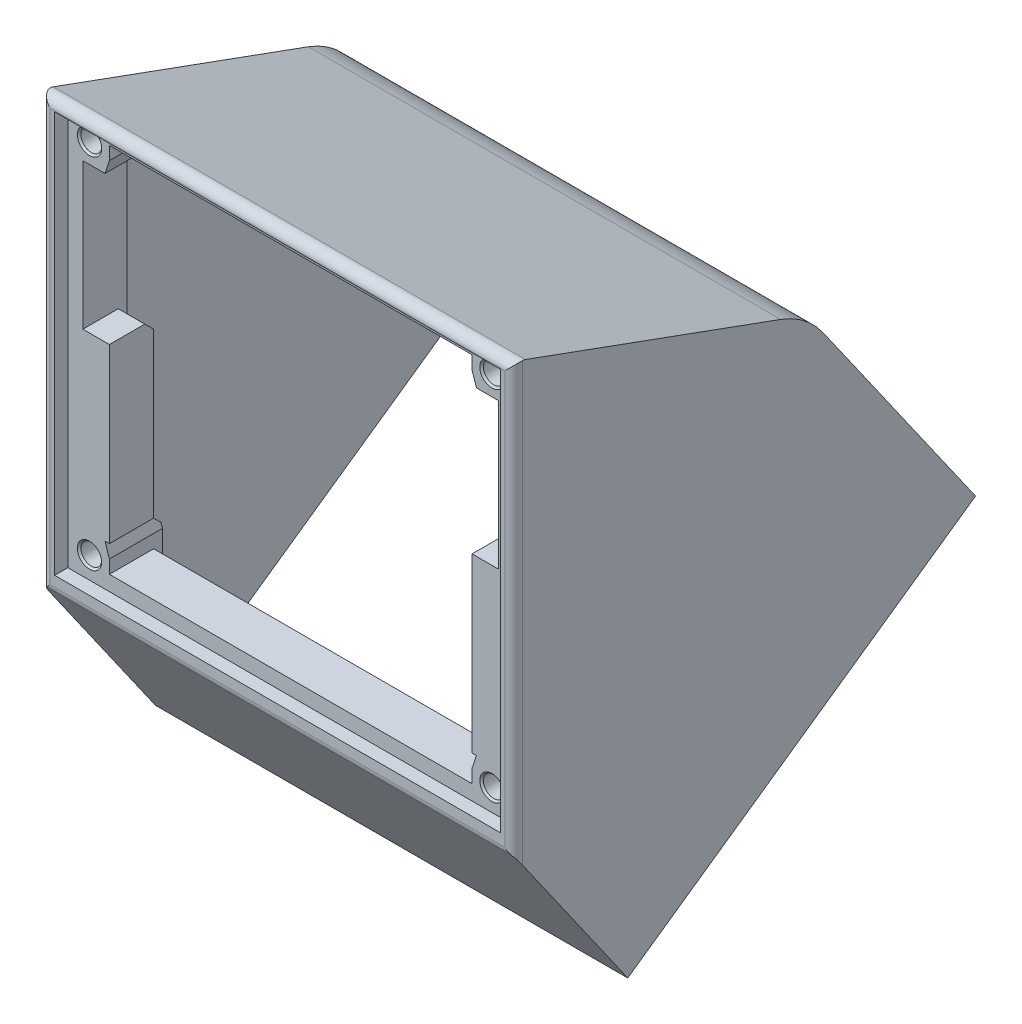
from build123d import *

# Parameters (mm, degrees)
SKETCH2_W                        = 100.8
SKETCH2_H                        = 90.8
CORNERS_DEPTH                    = 10
BOSS_EXTRUDE4_START              = -12
BOSS_EXTRUDE4_DEPTH              = 2
WALLS_W                          = 106.8
WALLS_H                          = 96.8
WALLS_W_2                        = 100.8
WALLS_H_2                        = 90.8
BOSS_EXTRUDE7_DEPTH              = 3
BOSS_EXTRUDE8_REACH              = 75.062
BOSS_EXTRUDE8_DIRECTION_2_REACH  = 75.062
BOSS_EXTRUDE25_DEPTH             = 3
BOSS_EXTRUDE27_START             = -106.8
BOSS_EXTRUDE27_DEPTH             = 3
BOSS_EXTRUDE28_REACH             = 144.875
BOSS_EXTRUDE28_DIRECTION_2_REACH = 144.875
BOSS_EXTRUDE29_START             = -47
BOSS_EXTRUDE29_DEPTH             = 3.4
BOSS_EXTRUDE30_START             = 47
BOSS_EXTRUDE30_DEPTH             = 3.4
CUT_EXTRUDE1_DEPTH               = 143.874595474
CUT_EXTRUDE1_DEPTH_BACK          = 143.874595474
BOSS_EXTRUDE31_START             = -42
BOSS_EXTRUDE31_DEPTH             = 8.4
BOSS_EXTRUDE32_START             = 42
BOSS_EXTRUDE32_DEPTH             = 8.4
SKETCH12_W                       = 100.8
SKETCH12_H                       = 90.8
CUT_EXTRUDE5_DEPTH               = 3
CHAMFER1_SIZE                    = 10
SKETCH13_R                       = 2.35
SKETCH13_R_2                     = 1.8
CUT_EXTRUDE6_DEPTH               = 4.5
BOSS_EXTRUDE33_START             = -41
BOSS_EXTRUDE33_DEPTH             = 6
BOSS_EXTRUDE34_START             = 41
BOSS_EXTRUDE34_DEPTH             = 6
FILLET1_R                        = 20
FILLET2_R                        = 2
CHAMFER2_SIZE                    = 3.4
SKETCH13_2_R                     = 1.8
CUT_EXTRUDE7_DEPTH               = 8
CHAMFER3_SIZE                    = 1
BOSS_EXTRUDE35_REACH             = 144.875
SKETCH2_15_R                     = 1.8
CUT_EXTRUDE8_DEPTH               = 8
SKETCH2_16_R                     = 1.8
CUT_EXTRUDE9_DEPTH               = 8
SKETCH2_17_R                     = 2.35
CUT_EXTRUDE10_DEPTH              = 4.4
CHAMFER4_SIZE                    = 0.4
CHAMFER5_SIZE                    = 0.4
CHAMFER6_SIZE                    = 2
CHAMFER7_SIZE                    = 1.5
CUT_EXTRUDE11_REACH              = 147.652
SKETCH14_R                       = 6.5


# Read off the part's stored shape, not the designer's step: Boss-Extrude4
with BuildPart() as part:
    # Sketch2 → Corners (new body)
    with BuildSketch(Plane.XY):
        Rectangle(SKETCH2_W, SKETCH2_H)
        with BuildLine():
            Line((-46.494987437, -42), (-47, -42))
            Line((-47, -42), (-47, -41.494987437))
            ThreePointArc((-47, -41.494987437), (-44.227207794, -39.227207794), (-46.494987437, -42))
        make_face(mode=Mode.SUBTRACT)
        Polygon((-47, 36), (-42, 36), (-41, 39), (-41, 42), (41, 42), (41, 39), (42, 36), (47, 36), (47, 3), (41, 3), (41, -3), (47, -3), (47, -36), (42, -36), (41, -39), (41, -42), (-41, -42), (-41, -39), (-42, -36), (-47, -36), (-47, -3), (-41, -3), (-41, 3), (-47, 3), align=None, mode=Mode.SUBTRACT)
        with BuildLine():
            Line((-47, 41.494987437), (-47, 42))
            Line((-47, 42), (-46.494987437, 42))
            ThreePointArc((-46.494987437, 42), (-44.227207794, 39.227207794), (-47, 41.494987437))
        make_face(mode=Mode.SUBTRACT)
    extrude(amount=-CORNERS_DEPTH)

    # Boss-Extrude4 outline → Boss-Extrude4 (add)
    with BuildSketch(Plane.XY.offset(BOSS_EXTRUDE4_START)):
        Polygon((41, -45.4), (50.4, -45.4), (50.4, -36), (42, -36), (41, -39), align=None)
        Polygon((42, 36), (50.4, 36), (50.4, 45.4), (41, 45.4), (41, 39), align=None)
        Polygon((-50.4, -45.4), (-41, -45.4), (-41, -39), (-42, -36), (-50.4, -36), align=None)
        Polygon((-41, 39), (-41, 45.4), (-50.4, 45.4), (-50.4, 36), (-42, 36), align=None)
    extrude(amount=BOSS_EXTRUDE4_DEPTH)


with BuildPart() as body_2:
    # Walls → Boss-Extrude7 (new body)
    with BuildSketch(Plane.XY):
        Rectangle(WALLS_W, WALLS_H)
        Rectangle(WALLS_W_2, WALLS_H_2, mode=Mode.SUBTRACT)
    extrude(amount=BOSS_EXTRUDE7_DEPTH)

    # Boss-Extrude8: up to this face of the body (flat: up to its plane)
    boss_extrude8_end = Plane(body_2.part.faces().sort_by_distance((53.4, 0, 1.5))[0])
    # Sketch7 → Boss-Extrude8 (add, up to the picked face)
    with BuildSketch(Plane(origin=(0, 0, 0), x_dir=(0, 0, -1), z_dir=(1, 0, 0)), mode=Mode.PRIVATE) as boss_extrude8_sk1:
        Polygon((22.810939636, -85.261841993), (25.268395769, -83.541112684), (0, -47.454103633), (-3, -48.4), align=None)
    boss_extrude8_tool1 = split(extrude(boss_extrude8_sk1.sketch, amount=BOSS_EXTRUDE8_REACH, mode=Mode.PRIVATE), bisect_by=boss_extrude8_end, keep=Keep.BOTH, mode=Mode.PRIVATE)
    # Sketch7 → Boss-Extrude8 (add, up to the picked face)
    with BuildSketch(Plane(origin=(0, 0, 0), x_dir=(0, 0, -1), z_dir=(1, 0, 0)), mode=Mode.PRIVATE) as boss_extrude8_sk2:
        Polygon((63.314946811, 24.263333274), (-3, 48.4), (-3, 45.207466683), (61.400034546, 21.767771022), (98.992079755, -31.919233412), (101.449535888, -30.198504103), align=None)
    boss_extrude8_tool2 = split(extrude(boss_extrude8_sk2.sketch, amount=BOSS_EXTRUDE8_REACH, mode=Mode.PRIVATE), bisect_by=boss_extrude8_end, keep=Keep.BOTH, mode=Mode.PRIVATE)
    add(boss_extrude8_tool1.solids().sort_by(Axis((0, -66.166625, -11.265003), (1, 0, 0)))[0])
    add(boss_extrude8_tool2.solids().sort_by(Axis((0, 35.093521, -29.706825), (1, 0, 0)))[0])

    # Boss-Extrude8 direction 2: up to this face of the body (flat: up to its plane)
    boss_extrude8_direction_2_end = Plane(body_2.part.faces().sort_by_distance((-53.4, 0, 1.5))[0])
    # Sketch7 → Boss-Extrude8 direction 2 (add, up to the picked face)
    with BuildSketch(Plane(origin=(0, 0, 0), x_dir=(0, 0, -1), z_dir=(1, 0, 0)), mode=Mode.PRIVATE) as boss_extrude8_direction_2_sk1:
        Polygon((22.810939636, -85.261841993), (25.268395769, -83.541112684), (0, -47.454103633), (-3, -48.4), align=None)
    boss_extrude8_direction_2_tool1 = split(extrude(boss_extrude8_direction_2_sk1.sketch, amount=-BOSS_EXTRUDE8_DIRECTION_2_REACH, mode=Mode.PRIVATE), bisect_by=boss_extrude8_direction_2_end, keep=Keep.BOTH, mode=Mode.PRIVATE)
    # Sketch7 → Boss-Extrude8 direction 2 (add, up to the picked face)
    with BuildSketch(Plane(origin=(0, 0, 0), x_dir=(0, 0, -1), z_dir=(1, 0, 0)), mode=Mode.PRIVATE) as boss_extrude8_direction_2_sk2:
        Polygon((63.314946811, 24.263333274), (-3, 48.4), (-3, 45.207466683), (61.400034546, 21.767771022), (98.992079755, -31.919233412), (101.449535888, -30.198504103), align=None)
    boss_extrude8_direction_2_tool2 = split(extrude(boss_extrude8_direction_2_sk2.sketch, amount=-BOSS_EXTRUDE8_DIRECTION_2_REACH, mode=Mode.PRIVATE), bisect_by=boss_extrude8_direction_2_end, keep=Keep.BOTH, mode=Mode.PRIVATE)
    add(boss_extrude8_direction_2_tool1.solids().sort_by(Axis((0, -66.166625, -11.265003), (-1, 0, 0)))[0])
    add(boss_extrude8_direction_2_tool2.solids().sort_by(Axis((0, 35.093521, -29.706825), (-1, 0, 0)))[0])


with BuildPart() as body_3:
    # Sketch9 → Boss-Extrude25 (new body)
    with BuildSketch(Plane(origin=(53.4, 0, 0), x_dir=(0, 0, -1), z_dir=(1, 0, 0))):
        Polygon((98.992079755, -31.919233412), (61.400034546, 21.767771022), (0, 44.11555598), (0, -47.454103633), (25.268395769, -83.541112684), align=None)
    extrude(amount=-BOSS_EXTRUDE25_DEPTH)


with BuildPart() as body_2_1:
    add(body_2.part)

    # Combine1: union body 3
    add(body_3.part)


with BuildPart() as body_3_2:
    # Sketch9<2> → Boss-Extrude27 (new body)
    with BuildSketch(Plane(origin=(53.4, 0, 0), x_dir=(0, 0, -1), z_dir=(1, 0, 0)).offset(BOSS_EXTRUDE27_START)):
        Polygon((98.992079755, -31.919233412), (61.400034546, 21.767771022), (0, 44.11555598), (0, -47.454103633), (25.268395769, -83.541112684), align=None)
    extrude(amount=BOSS_EXTRUDE27_DEPTH)

    # Combine2: union body 2
    add(body_2_1.part)

    # Boss-Extrude28: up to this face of the body (flat: up to its plane)
    boss_extrude28_end = Plane(body_3_2.part.faces().sort_by_distance((50.4, -18.359669296, -37.054738997))[0])
    # Sketch11 → Boss-Extrude28 (add, up to the picked face)
    with BuildSketch(Plane(origin=(0, 0, 0), x_dir=(0, 0, -1), z_dir=(1, 0, 0)), mode=Mode.PRIVATE) as boss_extrude28_sk1:
        Polygon((0, -45.4), (12, -45.4), (12, -64.591879714), (0, -47.454103633), align=None)
    boss_extrude28_tool1 = split(extrude(boss_extrude28_sk1.sketch, amount=BOSS_EXTRUDE28_REACH, mode=Mode.PRIVATE), bisect_by=boss_extrude28_end, keep=Keep.BOTH, mode=Mode.PRIVATE)
    # Sketch11 → Boss-Extrude28 (add, up to the picked face)
    with BuildSketch(Plane(origin=(0, 0, 0), x_dir=(0, 0, -1), z_dir=(1, 0, 0)), mode=Mode.PRIVATE) as boss_extrude28_sk2:
        Polygon((10, -45.4), (12, -45.4), (10, -42), align=None)
    boss_extrude28_tool2 = split(extrude(boss_extrude28_sk2.sketch, amount=BOSS_EXTRUDE28_REACH, mode=Mode.PRIVATE), bisect_by=boss_extrude28_end, keep=Keep.BOTH, mode=Mode.PRIVATE)

    add(part.part)  # Boss-Extrude28 merges part
    add(boss_extrude28_tool1.solids().sort_by(Axis((0, -51.863492, -7.613272), (1, 0, 0)))[0])
    add(boss_extrude28_tool2.solids().sort_by(Axis((0, -44.266667, -10.666667), (1, 0, 0)))[0])

    # Boss-Extrude28 direction 2: up to this face of the body (flat: up to its plane)
    boss_extrude28_direction_2_end = Plane(body_3_2.part.faces().sort_by_distance((-50.4, -18.359669296, -37.054738997))[0])
    # Sketch11 → Boss-Extrude28 direction 2 (add, up to the picked face)
    with BuildSketch(Plane(origin=(0, 0, 0), x_dir=(0, 0, -1), z_dir=(1, 0, 0)), mode=Mode.PRIVATE) as boss_extrude28_direction_2_sk1:
        Polygon((0, -45.4), (12, -45.4), (12, -64.591879714), (0, -47.454103633), align=None)
    boss_extrude28_direction_2_tool1 = split(extrude(boss_extrude28_direction_2_sk1.sketch, amount=-BOSS_EXTRUDE28_DIRECTION_2_REACH, mode=Mode.PRIVATE), bisect_by=boss_extrude28_direction_2_end, keep=Keep.BOTH, mode=Mode.PRIVATE)
    # Sketch11 → Boss-Extrude28 direction 2 (add, up to the picked face)
    with BuildSketch(Plane(origin=(0, 0, 0), x_dir=(0, 0, -1), z_dir=(1, 0, 0)), mode=Mode.PRIVATE) as boss_extrude28_direction_2_sk2:
        Polygon((10, -45.4), (12, -45.4), (10, -42), align=None)
    boss_extrude28_direction_2_tool2 = split(extrude(boss_extrude28_direction_2_sk2.sketch, amount=-BOSS_EXTRUDE28_DIRECTION_2_REACH, mode=Mode.PRIVATE), bisect_by=boss_extrude28_direction_2_end, keep=Keep.BOTH, mode=Mode.PRIVATE)
    add(boss_extrude28_direction_2_tool1.solids().sort_by(Axis((0, -51.863492, -7.613272), (-1, 0, 0)))[0])
    add(boss_extrude28_direction_2_tool2.solids().sort_by(Axis((0, -44.266667, -10.666667), (-1, 0, 0)))[0])

    # Sketch11<3> → Boss-Extrude29 (add)
    with BuildSketch(Plane(origin=(0, 0, 0), x_dir=(0, 0, -1), z_dir=(1, 0, 0)).offset(BOSS_EXTRUDE29_START)):
        Polygon((10, -33.143703987), (12, -36), (10, -36), align=None)
    extrude(amount=-BOSS_EXTRUDE29_DEPTH)

    # Sketch11<4> → Boss-Extrude30 (add)
    with BuildSketch(Plane(origin=(0, 0, 0), x_dir=(0, 0, -1), z_dir=(1, 0, 0)).offset(BOSS_EXTRUDE30_START)):
        Polygon((10, -33.143703987), (12, -36), (10, -36), align=None)
    extrude(amount=BOSS_EXTRUDE30_DEPTH)

    # Sketch11<5> → Cut-Extrude1 (cut, two sides: drawn at the far end of the back side and taken through both)
    with BuildSketch(Plane(origin=(0, 0, 0), x_dir=(0, 0, -1), z_dir=(1, 0, 0)).offset(-CUT_EXTRUDE1_DEPTH_BACK)):
        Polygon((84.467883109, 58.872493769), (63.330221682, 24.257773676), (-3, 48.4), (-9.325937985, 52.343993172), (18.872110633, 83.481606239), align=None)
    extrude(amount=CUT_EXTRUDE1_DEPTH + CUT_EXTRUDE1_DEPTH_BACK, mode=Mode.SUBTRACT)

    # Sketch11<6> → Boss-Extrude31 (add)
    with BuildSketch(Plane(origin=(0, 0, 0), x_dir=(0, 0, -1), z_dir=(1, 0, 0)).offset(BOSS_EXTRUDE31_START)):
        Polygon((61.400034546, 21.767771022), (12, 39.747913169), (12, 36), align=None)
    extrude(amount=-BOSS_EXTRUDE31_DEPTH)

    # Sketch11<7> → Boss-Extrude32 (add)
    with BuildSketch(Plane(origin=(0, 0, 0), x_dir=(0, 0, -1), z_dir=(1, 0, 0)).offset(BOSS_EXTRUDE32_START)):
        Polygon((12, 36), (61.400034546, 21.767771022), (12, 39.747913169), align=None)
    extrude(amount=BOSS_EXTRUDE32_DEPTH)

    # Sketch12 → Cut-Extrude5 (cut)
    with BuildSketch(Plane.XY.offset(3)):
        Rectangle(SKETCH12_W, SKETCH12_H)
    extrude(amount=-CUT_EXTRUDE5_DEPTH, mode=Mode.SUBTRACT)

    # Chamfer1
    # the kernel refuses this chamfer: 10 mm, written as the material it adds along each edge
    with BuildSketch(Plane(origin=(-50.4, -43.525885946, 2.750567637), x_dir=(-0.027495876610586296, 0.5733595768003814, -0.8188423367539704), z_dir=(0, -0.8191520442889929, -0.5735764363510445))) as chamfer1_piece_1_section:
        Polygon((CHAMFER1_SIZE * 0.999621916911, CHAMFER1_SIZE * 0.0274958766106), (-CHAMFER1_SIZE * 0.0274958766106, CHAMFER1_SIZE * 0.999621916911), (0, 0), align=None)
    chamfer1_piece_1 = extrude(amount=48.849571966, mode=Mode.PRIVATE)
    chamfer1_piece_1 = split(chamfer1_piece_1, bisect_by=Plane(origin=(-48.839338636, -68.838358477, -12), z_dir=(0, 0, -1)), keep=Keep.TOP, mode=Mode.PRIVATE)
    add(chamfer1_piece_1)
    with BuildSketch(Plane(origin=(50.4, -31.919233412, -98.992079755), x_dir=(0.027495876610585612, -0.5733595768003819, 0.8188423367539702), z_dir=(0, 0.8191520442889927, 0.5735764363510449))) as chamfer1_piece_2_section:
        Polygon((CHAMFER1_SIZE * 0.999621916911, -CHAMFER1_SIZE * 0.0274958766106), (-CHAMFER1_SIZE * 0.0274958766106, -CHAMFER1_SIZE * 0.999621916911), (0, 0), align=None)
    chamfer1_piece_2 = extrude(amount=91.25656064, mode=Mode.PRIVATE)
    chamfer1_piece_2 = split(chamfer1_piece_2, bisect_by=Plane(origin=(47.256851932, 16.701032516, -84.092197381), z_dir=(0, -0.939692620785907, 0.3420201433256726)), keep=Keep.TOP, mode=Mode.PRIVATE)
    add(chamfer1_piece_2)
    with BuildSketch(Plane(origin=(50.4, -43.525885946, 2.750567637), x_dir=(-0.9996219169112968, -0.015770986920648242, 0.022523303535079843), z_dir=(0, -0.8191520442889929, -0.5735764363510445))) as chamfer1_piece_3_section:
        Polygon((CHAMFER1_SIZE * 0.999621916911, CHAMFER1_SIZE * 0.0274958766106), (-CHAMFER1_SIZE * 0.0274958766106, CHAMFER1_SIZE * 0.999621916911), (0, 0), align=None)
    chamfer1_piece_3 = extrude(amount=48.849571966, mode=Mode.PRIVATE)
    chamfer1_piece_3 = split(chamfer1_piece_3, bisect_by=Plane(origin=(47.208890318, -69.875255308, -12), z_dir=(0, 0, -1)), keep=Keep.TOP, mode=Mode.PRIVATE)
    add(chamfer1_piece_3)
    with BuildSketch(Plane(origin=(-50.4, -31.919233412, -98.992079755), x_dir=(-0.027495876610586986, -0.5733595768003819, 0.8188423367539703), z_dir=(0, 0.8191520442889927, 0.5735764363510449))) as chamfer1_piece_4_section:
        Polygon((CHAMFER1_SIZE * 0.999621916911, CHAMFER1_SIZE * 0.0274958766106), (-CHAMFER1_SIZE * 0.0274958766106, CHAMFER1_SIZE * 0.999621916911), (0, 0), align=None)
    chamfer1_piece_4 = extrude(amount=91.25656064, mode=Mode.PRIVATE)
    chamfer1_piece_4 = split(chamfer1_piece_4, bisect_by=Plane(origin=(-47.256851932, 16.701032516, -84.092197381), z_dir=(0, -0.939692620785907, 0.3420201433256726)), keep=Keep.TOP, mode=Mode.PRIVATE)
    add(chamfer1_piece_4)

    # Sketch13 → Cut-Extrude6 (cut)
    # profile 1 of 4: a face of its own
    with BuildSketch(Plane(origin=(0, -67.92919053, -47.564531274), x_dir=(1, 0, 0), z_dir=(0, -0.8191520442889929, -0.5735764363510447))):
        with Locations(Location((-48.699692934, 25.518248586, 0), (0, 0, 270))):
            Circle(SKETCH13_R)
        with Locations(Location((-48.699692934, 25.518248586, 0), (0, 0, 270))):
            Circle(SKETCH13_R_2, mode=Mode.SUBTRACT)
    # profile 2 of 4: a face of its own
    with BuildSketch(Plane(origin=(0, -67.92919053, -47.564531274), x_dir=(1, 0, 0), z_dir=(0, -0.8191520442889929, -0.5735764363510447))):
        with Locations(Location((-48.699692934, -61.081137282, 0), (0, 0, 90))):
            Circle(SKETCH13_R)
        with Locations(Location((-48.699692934, -61.081137282, 0), (0, 0, 90))):
            Circle(SKETCH13_R_2, mode=Mode.SUBTRACT)
    # profile 3 of 4: a face of its own
    with BuildSketch(Plane(origin=(0, -67.92919053, -47.564531274), x_dir=(1, 0, 0), z_dir=(0, -0.8191520442889929, -0.5735764363510447))):
        with Locations(Location((48.699692934, 25.518248586, 0), (0, 0, 90))):
            Circle(SKETCH13_R)
        with Locations(Location((48.699692934, 25.518248586, 0), (0, 0, 90))):
            Circle(SKETCH13_R_2, mode=Mode.SUBTRACT)
    # profile 4 of 4: a face of its own
    with BuildSketch(Plane(origin=(0, -67.92919053, -47.564531274), x_dir=(1, 0, 0), z_dir=(0, -0.8191520442889929, -0.5735764363510447))):
        with Locations(Location((48.699692934, -61.081137282, 0), (0, 0, 270))):
            Circle(SKETCH13_R)
        with Locations(Location((48.699692934, -61.081137282, 0), (0, 0, 270))):
            Circle(SKETCH13_R_2, mode=Mode.SUBTRACT)
    extrude(amount=-CUT_EXTRUDE6_DEPTH, mode=Mode.SUBTRACT)

    # Sketch11<8> → Boss-Extrude33 (add)
    with BuildSketch(Plane(origin=(0, 0, 0), x_dir=(0, 0, -1), z_dir=(1, 0, 0)).offset(BOSS_EXTRUDE33_START)):
        Polygon((0, -36), (10, -36), (10, -33.143703987), (10, -3), (0, -3), align=None)
    extrude(amount=-BOSS_EXTRUDE33_DEPTH)

    # Sketch11<9> → Boss-Extrude34 (add)
    with BuildSketch(Plane(origin=(0, 0, 0), x_dir=(0, 0, -1), z_dir=(1, 0, 0)).offset(BOSS_EXTRUDE34_START)):
        Polygon((0, -36), (10, -36), (10, -33.143703987), (10, -3), (0, -3), align=None)
    extrude(amount=BOSS_EXTRUDE34_DEPTH)

    # Fillet1
    fillet1_edges = [body_3_2.edges().sort_by_distance(p)[0] for p in [
        (0, 24.263333274, -63.314946811),
    ]]
    fillet(fillet1_edges, radius=FILLET1_R)

    # Fillet2
    fillet2_edges = [body_3_2.edges().sort_by_distance(p)[0] for p in [
        (53.4, 0, 3),
        (0, 48.4, 3),
        (-53.4, 0, 3),
        (0, -48.4, 3),
    ]]
    fillet(fillet2_edges, radius=FILLET2_R)

    # Chamfer2
    chamfer2_edges = [body_3_2.edges().sort_by_distance(p)[0] for p in [
        (-50.4, 1.428148007, -10),
        (50.4, 1.428148007, -10),
    ]]
    chamfer(chamfer2_edges, length=CHAMFER2_SIZE)

    # Sketch13<2> → Cut-Extrude7 (cut)
    with BuildSketch(Plane(origin=(0, -67.92919053, -47.564531274), x_dir=(1, 0, 0), z_dir=(0, -0.8191520442889929, -0.5735764363510447))):
        with Locations(Location((-48.699692934, 25.518248586, 0), (0, 0, 270))):
            Circle(SKETCH13_2_R)
        with Locations(Location((-48.699692934, -61.081137282, 0), (0, 0, 270))):
            Circle(SKETCH13_2_R)
        with Locations(Location((48.699692934, -61.081137282, 0), (0, 0, 270))):
            Circle(SKETCH13_2_R)
        with Locations(Location((48.699692934, 25.518248586, 0), (0, 0, 270))):
            Circle(SKETCH13_2_R)
    extrude(amount=-CUT_EXTRUDE7_DEPTH, mode=Mode.SUBTRACT)

    # Chamfer3
    # the kernel refuses this chamfer: 1 mm, written as the material it takes off along each edge
    with BuildSketch(Plane(origin=(-48.699692934, -29.208305281, -95.018175782), x_dir=(-3.947459643111658e-15, 0.5735764363510443, -0.8191520442889929), z_dir=(1, 0, 0))) as chamfer3_piece_1_section:
        Polygon((1.8 + CHAMFER3_SIZE, 0), (1.8, CHAMFER3_SIZE), (1.8, 0), align=None)
    chamfer3_piece_1 = revolve(axis=Axis((-48.699692934, -29.208305281, -95.018175782), (-1.613706138091655e-15, 0.8191520442889931, 0.5735764363510443)), mode=Mode.PRIVATE)
    chamfer3_piece_1 = chamfer3_piece_1 & Plane(origin=(-48.699692934, -28.613073849, -94.601390247), x_dir=(0, -0.5735764363510447, 0.8191520442889929), z_dir=(0, -0.8191520442889929, -0.5735764363510447)) * Cylinder(2.35, 12, mode=Mode.PRIVATE)
    add(chamfer3_piece_1, mode=Mode.SUBTRACT)
    with BuildSketch(Plane(origin=(48.699692934, -29.208305281, -95.018175782), x_dir=(0, 0.5735764363510457, -0.8191520442889921), z_dir=(-1, 0, 0))) as chamfer3_piece_2_section:
        Polygon((1.8 + CHAMFER3_SIZE, 0), (1.8, -CHAMFER3_SIZE), (1.8, 0), align=None)
    chamfer3_piece_2 = revolve(axis=Axis((48.699692934, -29.208305281, -95.018175782), (0, -0.8191520442889929, -0.5735764363510447)), mode=Mode.PRIVATE)
    chamfer3_piece_2 = chamfer3_piece_2 & Plane(origin=(48.699692934, -28.613073849, -94.601390247), x_dir=(0, 0.5735764363510447, -0.8191520442889929), z_dir=(0, -0.8191520442889929, -0.5735764363510447)) * Cylinder(2.35, 12, mode=Mode.PRIVATE)
    add(chamfer3_piece_2, mode=Mode.SUBTRACT)
    with BuildSketch(Plane(origin=(48.699692934, -78.879672417, -24.080111814), x_dir=(0, 0.5735764363510439, -0.8191520442889932), z_dir=(1, 0, 0))) as chamfer3_piece_3_section:
        Polygon((1.8 + CHAMFER3_SIZE, 0), (1.8, CHAMFER3_SIZE), (1.8, 0), align=None)
    chamfer3_piece_3 = revolve(axis=Axis((48.699692934, -78.879672417, -24.080111814), (-3.227412276183318e-15, 0.8191520442889915, 0.5735764363510466)), mode=Mode.PRIVATE)
    chamfer3_piece_3 = chamfer3_piece_3 & Plane(origin=(48.699692934, -78.284440985, -23.663326279), x_dir=(0, -0.5735764363510447, 0.8191520442889929), z_dir=(0, -0.8191520442889929, -0.5735764363510447)) * Cylinder(2.35, 12, mode=Mode.PRIVATE)
    add(chamfer3_piece_3, mode=Mode.SUBTRACT)
    with BuildSketch(Plane(origin=(-48.699692934, -78.879672417, -24.080111814), x_dir=(0, 0.5735764363510493, -0.8191520442889896), z_dir=(-1, 0, 0))) as chamfer3_piece_4_section:
        Polygon((1.8 + CHAMFER3_SIZE, 0), (1.8, -CHAMFER3_SIZE), (1.8, 0), align=None)
    chamfer3_piece_4 = revolve(axis=Axis((-48.699692934, -78.879672417, -24.080111814), (0, -0.8191520442889929, -0.5735764363510447)), mode=Mode.PRIVATE)
    chamfer3_piece_4 = chamfer3_piece_4 & Plane(origin=(-48.699692934, -78.284440985, -23.663326279), x_dir=(0, 0.5735764363510447, -0.8191520442889929), z_dir=(0, -0.8191520442889929, -0.5735764363510447)) * Cylinder(2.35, 12, mode=Mode.PRIVATE)
    add(chamfer3_piece_4, mode=Mode.SUBTRACT)

    # Sketch2<14> → Boss-Extrude35 (add, up to next)
    with BuildSketch(Plane.XY, mode=Mode.PRIVATE) as boss_extrude35_sk1:
        with BuildLine():
            ThreePointArc((-43.7, -40.5), (-44.980384758, -38.776631206), (-47, -39.505012563))
            Line((-47, -39.505012563), (-47, -41.494987437))
            ThreePointArc((-47, -41.494987437), (-46.772792206, -41.772792206), (-46.494987437, -42))
            Line((-46.494987437, -42), (-44.505012563, -42))
            ThreePointArc((-44.505012563, -42), (-43.913970778, -41.351182299), (-43.7, -40.5))
        make_face()
    boss_extrude35_tool1 = extrude(boss_extrude35_sk1.sketch, amount=-BOSS_EXTRUDE35_REACH, mode=Mode.PRIVATE) - body_3_2.part
    # Sketch2<14> → Boss-Extrude35 (add, up to next)
    with BuildSketch(Plane.XY, mode=Mode.PRIVATE) as boss_extrude35_sk2:
        with BuildLine():
            ThreePointArc((-46.494987437, -42), (-46.772792206, -41.772792206), (-47, -41.494987437))
            Line((-47, -41.494987437), (-47, -42))
            Line((-47, -42), (-46.494987437, -42))
        make_face()
    boss_extrude35_tool2 = extrude(boss_extrude35_sk2.sketch, amount=-BOSS_EXTRUDE35_REACH, mode=Mode.PRIVATE) - body_3_2.part
    # Sketch2<14> → Boss-Extrude35 (add, up to next)
    with BuildSketch(Plane.XY, mode=Mode.PRIVATE) as boss_extrude35_sk3:
        with BuildLine():
            ThreePointArc((-43.7, -40.5), (-44.980384758, -38.776631206), (-47, -39.505012563))
            Line((-47, -39.505012563), (-47, -41.494987437))
            ThreePointArc((-47, -41.494987437), (-46.772792206, -41.772792206), (-46.494987437, -42))
            Line((-46.494987437, -42), (-44.505012563, -42))
            ThreePointArc((-44.505012563, -42), (-43.913970778, -41.351182299), (-43.7, -40.5))
        make_face()
    boss_extrude35_tool3 = extrude(boss_extrude35_sk3.sketch, amount=-BOSS_EXTRUDE35_REACH, mode=Mode.PRIVATE) - body_3_2.part
    # Sketch2<14> → Boss-Extrude35 (add, up to next)
    with BuildSketch(Plane.XY, mode=Mode.PRIVATE) as boss_extrude35_sk4:
        with BuildLine():
            ThreePointArc((-46.494987437, -42), (-46.772792206, -41.772792206), (-47, -41.494987437))
            Line((-47, -41.494987437), (-47, -42))
            Line((-47, -42), (-46.494987437, -42))
        make_face()
    boss_extrude35_tool4 = extrude(boss_extrude35_sk4.sketch, amount=-BOSS_EXTRUDE35_REACH, mode=Mode.PRIVATE) - body_3_2.part
    # Sketch2<14> → Boss-Extrude35 (add, up to next)
    with BuildSketch(Plane.XY, mode=Mode.PRIVATE) as boss_extrude35_sk5:
        with BuildLine():
            ThreePointArc((-46.494987437, -42), (-45.5, -42.3), (-44.505012563, -42))
            Line((-44.505012563, -42), (-46.494987437, -42))
        make_face()
    boss_extrude35_tool5 = extrude(boss_extrude35_sk5.sketch, amount=-BOSS_EXTRUDE35_REACH, mode=Mode.PRIVATE) - body_3_2.part
    # Sketch2<14> → Boss-Extrude35 (add, up to next)
    with BuildSketch(Plane.XY, mode=Mode.PRIVATE) as boss_extrude35_sk6:
        with BuildLine():
            Line((-47, 41.494987437), (-47, 39.505012563))
            ThreePointArc((-47, 39.505012563), (-44.980384758, 38.776631206), (-43.7, 40.5))
            ThreePointArc((-43.7, 40.5), (-43.913970778, 41.351182299), (-44.505012563, 42))
            Line((-44.505012563, 42), (-46.494987437, 42))
            ThreePointArc((-46.494987437, 42), (-46.772792206, 41.772792206), (-47, 41.494987437))
        make_face()
    boss_extrude35_tool6 = extrude(boss_extrude35_sk6.sketch, amount=-BOSS_EXTRUDE35_REACH, mode=Mode.PRIVATE) - body_3_2.part
    # Sketch2<14> → Boss-Extrude35 (add, up to next)
    with BuildSketch(Plane.XY, mode=Mode.PRIVATE) as boss_extrude35_sk7:
        with BuildLine():
            Line((-47, 42), (-47, 41.494987437))
            ThreePointArc((-47, 41.494987437), (-46.772792206, 41.772792206), (-46.494987437, 42))
            Line((-46.494987437, 42), (-47, 42))
        make_face()
    boss_extrude35_tool7 = extrude(boss_extrude35_sk7.sketch, amount=-BOSS_EXTRUDE35_REACH, mode=Mode.PRIVATE) - body_3_2.part
    # Sketch2<14> → Boss-Extrude35 (add, up to next)
    with BuildSketch(Plane.XY, mode=Mode.PRIVATE) as boss_extrude35_sk8:
        with BuildLine():
            ThreePointArc((-47, 41.494987437), (-47.3, 40.5), (-47, 39.505012563))
            Line((-47, 39.505012563), (-47, 41.494987437))
        make_face()
    boss_extrude35_tool8 = extrude(boss_extrude35_sk8.sketch, amount=-BOSS_EXTRUDE35_REACH, mode=Mode.PRIVATE) - body_3_2.part
    # Sketch2<14> → Boss-Extrude35 (add, up to next)
    with BuildSketch(Plane.XY, mode=Mode.PRIVATE) as boss_extrude35_sk9:
        with BuildLine():
            Line((-46.494987437, 42), (-44.505012563, 42))
            ThreePointArc((-44.505012563, 42), (-45.5, 42.3), (-46.494987437, 42))
        make_face()
    boss_extrude35_tool9 = extrude(boss_extrude35_sk9.sketch, amount=-BOSS_EXTRUDE35_REACH, mode=Mode.PRIVATE) - body_3_2.part
    # Sketch2<14> → Boss-Extrude35 (add, up to next)
    with BuildSketch(Plane.XY, mode=Mode.PRIVATE) as boss_extrude35_sk10:
        with BuildLine():
            Line((-47, 41.494987437), (-47, 39.505012563))
            ThreePointArc((-47, 39.505012563), (-44.980384758, 38.776631206), (-43.7, 40.5))
            ThreePointArc((-43.7, 40.5), (-43.913970778, 41.351182299), (-44.505012563, 42))
            Line((-44.505012563, 42), (-46.494987437, 42))
            ThreePointArc((-46.494987437, 42), (-46.772792206, 41.772792206), (-47, 41.494987437))
        make_face()
    boss_extrude35_tool10 = extrude(boss_extrude35_sk10.sketch, amount=-BOSS_EXTRUDE35_REACH, mode=Mode.PRIVATE) - body_3_2.part
    # Sketch2<14> → Boss-Extrude35 (add, up to next)
    with BuildSketch(Plane.XY, mode=Mode.PRIVATE) as boss_extrude35_sk11:
        with BuildLine():
            Line((-47, 42), (-47, 41.494987437))
            ThreePointArc((-47, 41.494987437), (-46.772792206, 41.772792206), (-46.494987437, 42))
            Line((-46.494987437, 42), (-47, 42))
        make_face()
    boss_extrude35_tool11 = extrude(boss_extrude35_sk11.sketch, amount=-BOSS_EXTRUDE35_REACH, mode=Mode.PRIVATE) - body_3_2.part
    # Sketch2<14> → Boss-Extrude35 (add, up to next)
    with BuildSketch(Plane.XY, mode=Mode.PRIVATE) as boss_extrude35_sk12:
        with BuildLine():
            Line((-47, -41.494987437), (-47, -39.505012563))
            ThreePointArc((-47, -39.505012563), (-47.3, -40.5), (-47, -41.494987437))
        make_face()
    boss_extrude35_tool12 = extrude(boss_extrude35_sk12.sketch, amount=-BOSS_EXTRUDE35_REACH, mode=Mode.PRIVATE) - body_3_2.part
    add(boss_extrude35_tool1.solids().sort_by_distance((-45.429904, -40.429904, 0))[0])
    add(boss_extrude35_tool2.solids().sort_by_distance((-46.843105, -41.843105, 0))[0])
    add(boss_extrude35_tool3.solids().sort_by_distance((-45.429904, -40.429904, 0))[0])
    add(boss_extrude35_tool4.solids().sort_by_distance((-46.843105, -41.843105, 0))[0])
    add(boss_extrude35_tool5.solids().sort_by_distance((-45.5, -42.120901, 0))[0])
    add(boss_extrude35_tool6.solids().sort_by_distance((-45.429904, 40.429904, 0))[0])
    add(boss_extrude35_tool7.solids().sort_by_distance((-46.843105, 41.843105, 0))[0])
    add(boss_extrude35_tool8.solids().sort_by_distance((-47.120901, 40.5, 0))[0])
    add(boss_extrude35_tool9.solids().sort_by_distance((-45.5, 42.120901, 0))[0])
    add(boss_extrude35_tool10.solids().sort_by_distance((-45.429904, 40.429904, 0))[0])
    add(boss_extrude35_tool11.solids().sort_by_distance((-46.843105, 41.843105, 0))[0])
    add(boss_extrude35_tool12.solids().sort_by_distance((-47.120901, -40.5, 0))[0])

    # Sketch2<15> → Cut-Extrude8 (cut)
    with BuildSketch(Plane.XY):
        with Locations(Location((45.5, 40.5, 0), (0, 0, 180))):
            Circle(SKETCH2_15_R)
        with Locations((45.5, -40.5)):
            Circle(SKETCH2_15_R)
        with Locations(Location((-45.5, -40.5, 0), (0, 0, 180))):
            Circle(SKETCH2_15_R)
    extrude(amount=-CUT_EXTRUDE8_DEPTH, mode=Mode.SUBTRACT)

    # Sketch2<16> → Cut-Extrude9 (cut)
    with BuildSketch(Plane.XY):
        with Locations((-45.5, 40.5)):
            Circle(SKETCH2_16_R)
    extrude(amount=-CUT_EXTRUDE9_DEPTH, mode=Mode.SUBTRACT)

    # Sketch2<17> → Cut-Extrude10 (cut)
    with BuildSketch(Plane.XY):
        with Locations((-45.5, 40.5)):
            Circle(SKETCH2_17_R)
        with Locations(Location((45.5, 40.5, 0), (0, 0, 180))):
            Circle(SKETCH2_17_R)
        with Locations((45.5, -40.5)):
            Circle(SKETCH2_17_R)
        with Locations(Location((-45.5, -40.5, 0), (0, 0, 180))):
            Circle(SKETCH2_17_R)
    extrude(amount=-CUT_EXTRUDE10_DEPTH, mode=Mode.SUBTRACT)

    # Chamfer4
    chamfer4_edges = [body_3_2.edges().sort_by_distance(p)[0] for p in [
        (-47.3, 40.5, -4.4),
        (-43.7, -40.5, -4.4),
        (43.7, -40.5, -4.4),
        (47.3, 40.5, -4.4),
    ]]
    chamfer(chamfer4_edges, length=CHAMFER4_SIZE)

    # Chamfer5
    chamfer5_edges = [body_3_2.edges().sort_by_distance(p)[0] for p in [
        (-47.85, 40.5, 0),
        (-43.15, -40.5, 0),
        (43.15, -40.5, 0),
        (47.85, 40.5, 0),
    ]]
    chamfer(chamfer5_edges, length=CHAMFER5_SIZE)

    # Chamfer6
    # the kernel refuses this chamfer: 2 mm, written as the material it takes off along each edge
    with BuildSketch(Plane(origin=(47, 3, -10), x_dir=(0, 0.02749587661058627, 0.9996219169112968), z_dir=(-1, 0, 0)), Plane(origin=(-35.856634024, 3, -10), x_dir=(0, 0.02749587661058627, 0.9996219169112968), z_dir=(-1, 0, 0))) as chamfer6_piece_1:
        Polygon((CHAMFER6_SIZE * 0.999621916911, -CHAMFER6_SIZE * 0.0274958766106), (-CHAMFER6_SIZE * 0.0274958766106, -CHAMFER6_SIZE * 0.999621916911), (0, 0), align=None)
    extrude(amount=11.143365976, mode=Mode.SUBTRACT)
    with BuildSketch(Plane(origin=(-36.856634024, -36, -12), x_dir=(0, -0.9996219169112968, -0.02749587661058651), z_dir=(-1, 0, 0)), Plane(origin=(47, -36, -12), x_dir=(0, -0.9996219169112968, -0.027495876610583826), z_dir=(-1, 0, 0))) as chamfer6_piece_2:
        Polygon((CHAMFER6_SIZE * 0.999621916911, CHAMFER6_SIZE * 0.0274958766106), (-CHAMFER6_SIZE * 0.0274958766106, CHAMFER6_SIZE * 0.999621916911), (0, 0), align=None)
    extrude(amount=10.143365976, mode=Mode.SUBTRACT)

    # Chamfer7
    # the kernel refuses this chamfer: 1.5 mm, written as the material it takes off along each edge
    with BuildSketch(Plane(origin=(-42, 37.067922225, -8.293244377), x_dir=(-0.9996219169112968, -0.026421217991013587, 0.007611995169193208), z_dir=(0, -0.276841334320762, -0.9609156443785792))) as chamfer7_piece_1_section:
        Polygon((CHAMFER7_SIZE * 0.999621916911, CHAMFER7_SIZE * 0.0274958766106), (-CHAMFER7_SIZE * 0.0274958766106, CHAMFER7_SIZE * 0.999621916911), (0, 0), align=None)
    chamfer7_piece_1 = extrude(amount=56.578017899, mode=Mode.PRIVATE)
    chamfer7_piece_1 = split(chamfer7_piece_1, bisect_by=Plane(origin=(-42.341686542, 36, -13.41222977), z_dir=(0, 1, 0)), keep=Keep.TOP, mode=Mode.PRIVATE)
    chamfer7_piece_1 = split(chamfer7_piece_1, bisect_by=Plane(origin=(-42.341686542, 36.406865656, -12), z_dir=(0, 0, -1)), keep=Keep.TOP, mode=Mode.PRIVATE)
    add(chamfer7_piece_1, mode=Mode.SUBTRACT)
    with BuildSketch(Plane(origin=(-42, 37.067922225, -8.293244377), x_dir=(-0.9996219169112968, -0.026421217991013587, 0.007611995169193208), z_dir=(0, -0.276841334320762, -0.9609156443785792))) as chamfer7_piece_2_section:
        Polygon((CHAMFER7_SIZE * 0.999621916911, CHAMFER7_SIZE * 0.0274958766106), (-CHAMFER7_SIZE * 0.0274958766106, CHAMFER7_SIZE * 0.999621916911), (0, 0), align=None)
    chamfer7_piece_2 = extrude(amount=56.578017899, mode=Mode.PRIVATE)
    chamfer7_piece_2 = split(chamfer7_piece_2, bisect_by=Plane(origin=(-42.520758893, 36, -34.051444885), z_dir=(0, -1, 0)), keep=Keep.TOP, mode=Mode.PRIVATE)
    chamfer7_piece_2 = split(chamfer7_piece_2, bisect_by=Plane(origin=(-50.270421792, 34.550948668, -40.399597092), z_dir=(0.7071067811862668, -0.40557978767277536, 0.5792279653398166)), keep=Keep.TOP, mode=Mode.PRIVATE)
    chamfer7_piece_2 = split(chamfer7_piece_2, bisect_by=Plane(origin=(-42.520758893, 30.105924639, -12), z_dir=(0, 0, -1)), keep=Keep.TOP, mode=Mode.PRIVATE)
    chamfer7_piece_2 = split(chamfer7_piece_2, bisect_by=Plane(origin=(-42.520758893, 31.532816997, -34.570791231), z_dir=(0, -0.9396926207859071, 0.34202014332567243)), keep=Keep.TOP, mode=Mode.PRIVATE)
    add(chamfer7_piece_2, mode=Mode.SUBTRACT)
    with BuildSketch(Plane(origin=(42, 37.067922225, -8.293244377), x_dir=(0.9996219169112968, -0.026421217991013587, 0.007611995169193208), z_dir=(0, -0.276841334320762, -0.9609156443785792))) as chamfer7_piece_3_section:
        Polygon((CHAMFER7_SIZE * 0.999621916911, -CHAMFER7_SIZE * 0.0274958766106), (-CHAMFER7_SIZE * 0.0274958766106, -CHAMFER7_SIZE * 0.999621916911), (0, 0), align=None)
    chamfer7_piece_3 = extrude(amount=56.578017899, mode=Mode.PRIVATE)
    chamfer7_piece_3 = split(chamfer7_piece_3, bisect_by=Plane(origin=(42.341686542, 36, -13.41222977), z_dir=(0, 1, 0)), keep=Keep.TOP, mode=Mode.PRIVATE)
    chamfer7_piece_3 = split(chamfer7_piece_3, bisect_by=Plane(origin=(42.341686542, 36.406865656, -12), z_dir=(0, 0, -1)), keep=Keep.TOP, mode=Mode.PRIVATE)
    add(chamfer7_piece_3, mode=Mode.SUBTRACT)
    with BuildSketch(Plane(origin=(42, 37.067922225, -8.293244377), x_dir=(0.9996219169112968, -0.026421217991013587, 0.007611995169193208), z_dir=(0, -0.276841334320762, -0.9609156443785792))) as chamfer7_piece_4_section:
        Polygon((CHAMFER7_SIZE * 0.999621916911, -CHAMFER7_SIZE * 0.0274958766106), (-CHAMFER7_SIZE * 0.0274958766106, -CHAMFER7_SIZE * 0.999621916911), (0, 0), align=None)
    chamfer7_piece_4 = extrude(amount=56.578017899, mode=Mode.PRIVATE)
    chamfer7_piece_4 = split(chamfer7_piece_4, bisect_by=Plane(origin=(42.520758893, 36, -34.051444885), z_dir=(0, -1, 0)), keep=Keep.TOP, mode=Mode.PRIVATE)
    chamfer7_piece_4 = split(chamfer7_piece_4, bisect_by=Plane(origin=(42.520758893, 31.532816997, -34.570791231), z_dir=(0, -0.9396926207859071, 0.34202014332567243)), keep=Keep.TOP, mode=Mode.PRIVATE)
    chamfer7_piece_4 = split(chamfer7_piece_4, bisect_by=Plane(origin=(42.520758893, 30.105924639, -12), z_dir=(0, 0, -1)), keep=Keep.TOP, mode=Mode.PRIVATE)
    chamfer7_piece_4 = split(chamfer7_piece_4, bisect_by=Plane(origin=(50.270421792, 34.550948668, -40.399597092), z_dir=(-0.7071067811862668, -0.40557978767277536, 0.5792279653398166)), keep=Keep.TOP, mode=Mode.PRIVATE)
    add(chamfer7_piece_4, mode=Mode.SUBTRACT)

    # Sketch14 → Cut-Extrude11 (cut, up to next)
    with BuildSketch(Plane(origin=(0, 37.730686427, -53.885004614), x_dir=(-1, 0, 0), z_dir=(0, 0.5735764363510449, -0.8191520442889928)), mode=Mode.PRIVATE) as cut_extrude11_sk1:
        with Locations(Location((28.4, -57.926229635, 0), (0, 0, 90))):
            Circle(SKETCH14_R)
    cut_extrude11_tool1 = extrude(cut_extrude11_sk1.sketch, amount=-CUT_EXTRUDE11_REACH, mode=Mode.PRIVATE) & body_3_2.part
    add(cut_extrude11_tool1.solids().sort_by_distance((-28.4, -9.719703, -87.110125))[0], mode=Mode.SUBTRACT)


solid = body_3_2.part
